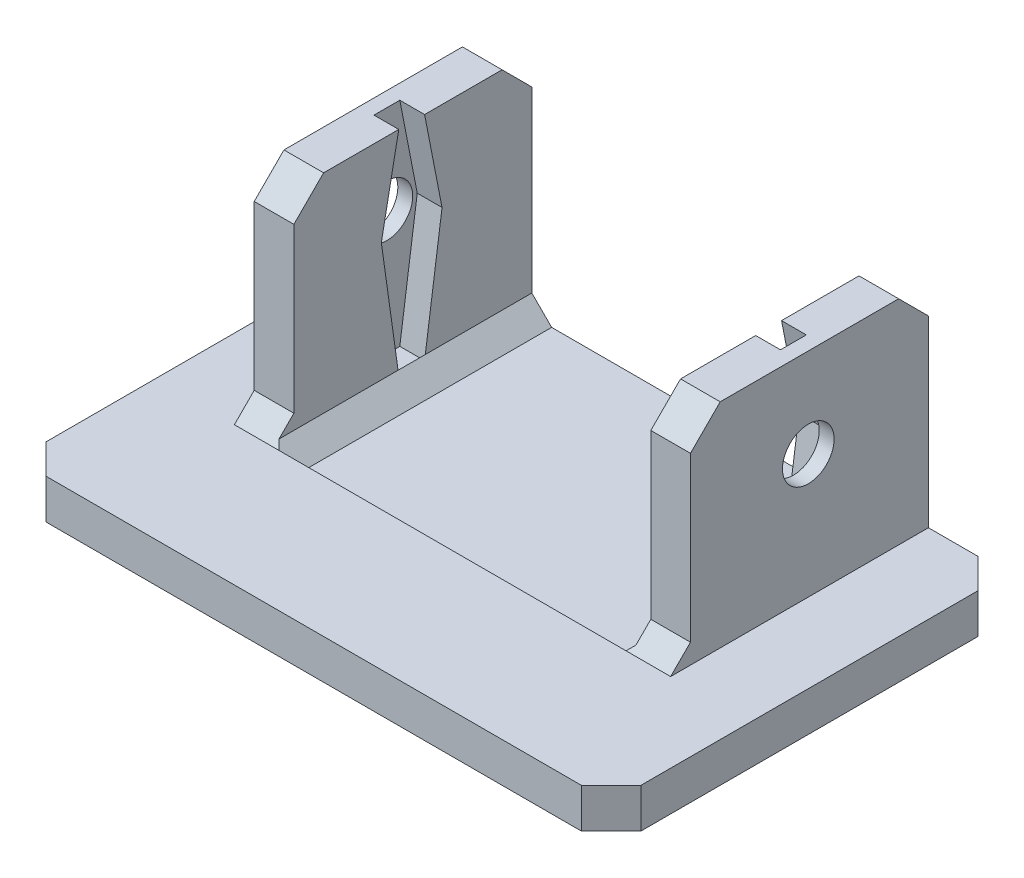
from build123d import *

# Parameters (mm, degrees)
SKETCH1_W           = 60
SKETCH1_H           = 40
BOSS_EXTRUDE1_DEPTH = 4
CHAMFER1_SIZE       = 3
SKETCH2_W           = 36
SKETCH2_H           = 24
CUT_EXTRUDE1_DEPTH  = 1.5
SKETCH3_W           = 4
SKETCH3_H           = 24
BOSS_EXTRUDE2_DEPTH = 23
CHAMFER2_SIZE       = 3
CHAMFER3_SIZE       = 2
CHAMFER4_SIZE       = 2
CHAMFER5_SIZE       = 2
CUT_EXTRUDE2_DEPTH  = 2.5
SKETCH7_R           = 2.604037506
CUT_EXTRUDE3_DEPTH  = 70.285640648
CUT_EXTRUDE4_DEPTH  = 2.5
SKETCH12_R          = 2.604037506
CUT_EXTRUDE6_DEPTH  = 68.485183559


with BuildPart() as part:
    # Sketch1 → Boss-Extrude1 (new body)
    with BuildSketch(Plane(origin=(0, 0, 0), x_dir=(1, 0, 0), z_dir=(0, 1, 0))):
        with Locations((30, -20)):
            Rectangle(SKETCH1_W, SKETCH1_H)
    extrude(amount=BOSS_EXTRUDE1_DEPTH)

    # Chamfer1
    chamfer1_edges = [part.edges().sort_by_distance(p)[0] for p in [
        (0, 2, 0),
        (60, 2, 0),
        (60, 2, 40),
        (0, 2, 40),
    ]]
    chamfer(chamfer1_edges, length=CHAMFER1_SIZE)

    # Sketch2 → Cut-Extrude1 (cut)
    with BuildSketch(Plane(origin=(0, 4, 0), x_dir=(1, 0, 0), z_dir=(0, 1, 0))):
        with Locations((30, -12)):
            Rectangle(SKETCH2_W, SKETCH2_H)
    extrude(amount=-CUT_EXTRUDE1_DEPTH, mode=Mode.SUBTRACT)

    # Sketch3 → Boss-Extrude2 (add)
    with BuildSketch(Plane(origin=(0, 2.5, 0), x_dir=(1, 0, 0), z_dir=(0, 1, 0))):
        with Locations((50, -12)):
            Rectangle(SKETCH3_W, SKETCH3_H)
        with Locations((10, -12)):
            Rectangle(SKETCH3_W, SKETCH3_H)
    extrude(amount=BOSS_EXTRUDE2_DEPTH)

    # Chamfer2
    chamfer2_edges = [part.edges().sort_by_distance(p)[0] for p in [
        (50, 25.5, 24),
        (50, 25.5, 0),
        (10, 25.5, 0),
        (10, 25.5, 24),
    ]]
    chamfer(chamfer2_edges, length=CHAMFER2_SIZE)

    # Chamfer3
    chamfer3_edges = [part.edges().sort_by_distance(p)[0] for p in [
        (50, 4, 24),
        (10, 4, 24),
    ]]
    chamfer(chamfer3_edges, length=CHAMFER3_SIZE)

    # Chamfer4
    # the kernel refuses this chamfer: 2 mm, written as the material it takes off along each edge
    with BuildSketch(Plane(origin=(48, 4, 24), x_dir=(0, -0.9996219169112968, -0.027495876610585623), z_dir=(-1, 0, 0))) as chamfer4_piece_1_section:
        Polygon((CHAMFER4_SIZE * 0.999621916911, CHAMFER4_SIZE * 0.0274958766106), (-CHAMFER4_SIZE * 0.0274958766106, CHAMFER4_SIZE * 0.999621916911), (0, 0), align=None)
    chamfer4_piece_1 = extrude(amount=36, mode=Mode.PRIVATE)
    chamfer4_piece_1 = split(chamfer4_piece_1, bisect_by=Plane(origin=(30, 2.5, 24.699033576), z_dir=(0, 1, 0)), keep=Keep.TOP, mode=Mode.PRIVATE)
    chamfer4_piece_1 = split(chamfer4_piece_1, bisect_by=Plane(origin=(30, 4.361799404, 25.638200596), z_dir=(0, -0.7071067811865476, -0.7071067811865476)), keep=Keep.TOP, mode=Mode.PRIVATE)
    add(chamfer4_piece_1, mode=Mode.SUBTRACT)

    # Chamfer5
    # the kernel refuses this chamfer: 2 mm, written as the material it adds along each edge
    with BuildSketch(Plane(origin=(12, 2.5, 29.643365976), x_dir=(-0.027495876610586487, 0.9996219169112968, 0), z_dir=(0, 0, -1))) as chamfer5_piece_1_section:
        Polygon((CHAMFER5_SIZE * 0.999621916911, CHAMFER5_SIZE * 0.0274958766106), (-CHAMFER5_SIZE * 0.0274958766106, CHAMFER5_SIZE * 0.999621916911), (0, 0), align=None)
    chamfer5_piece_1 = extrude(amount=29.643365976, mode=Mode.PRIVATE)
    chamfer5_piece_1 = split(chamfer5_piece_1, bisect_by=Plane(origin=(12.696713147, 10.276643426, 19.723356574), z_dir=(0, -0.7071067811865476, -0.7071067811865476)), keep=Keep.TOP, mode=Mode.PRIVATE)
    add(chamfer5_piece_1)
    with BuildSketch(Plane(origin=(48, 2.5, 29.643365976), x_dir=(-0.9996219169112968, -0.027495876610586296, 0), z_dir=(0, 0, -1))) as chamfer5_piece_2_section:
        Polygon((CHAMFER5_SIZE * 0.999621916911, CHAMFER5_SIZE * 0.0274958766106), (-CHAMFER5_SIZE * 0.0274958766106, CHAMFER5_SIZE * 0.999621916911), (0, 0), align=None)
    chamfer5_piece_2 = extrude(amount=29.643365976, mode=Mode.PRIVATE)
    chamfer5_piece_2 = split(chamfer5_piece_2, bisect_by=Plane(origin=(47.833064516, 10.624596774, 19.375403226), z_dir=(0, -0.7071067811865476, -0.7071067811865476)), keep=Keep.TOP, mode=Mode.PRIVATE)
    add(chamfer5_piece_2)

    # Sketch4 → Cut-Extrude2 (cut)
    with BuildSketch(Plane.ZY.offset(-48)):
        Polygon((9.05620064, 16.5), (10.815025537, 25.5), (13.420692052, 25.5), (15.179516949, 16.5), (13.420692052, 4), (10.815025537, 4), align=None)
    extrude(amount=-CUT_EXTRUDE2_DEPTH, mode=Mode.SUBTRACT)

    # Sketch7 → Cut-Extrude3 (cut, through all)
    with BuildSketch(Plane.ZY.offset(-50.5)):
        with Locations((12.117858795, 16.5)):
            Circle(SKETCH7_R)
    extrude(amount=-CUT_EXTRUDE3_DEPTH, mode=Mode.SUBTRACT)

    # Sketch11 → Cut-Extrude4 (cut)
    with BuildSketch(Plane.ZY.offset(-12)):
        Polygon((9.05620064, 16.5), (10.815025537, 25.5), (13.420692052, 25.5), (15.179516949, 16.5), (13.420692052, 4), (10.815025537, 4), align=None)
    extrude(amount=CUT_EXTRUDE4_DEPTH, mode=Mode.SUBTRACT)

    # Sketch12 → Cut-Extrude6 (cut, through all)
    with BuildSketch(Plane.ZY.offset(-12)):
        with Locations((12.117858795, 16.5)):
            Circle(SKETCH12_R)
    extrude(amount=CUT_EXTRUDE6_DEPTH, mode=Mode.SUBTRACT)


solid = part.part
